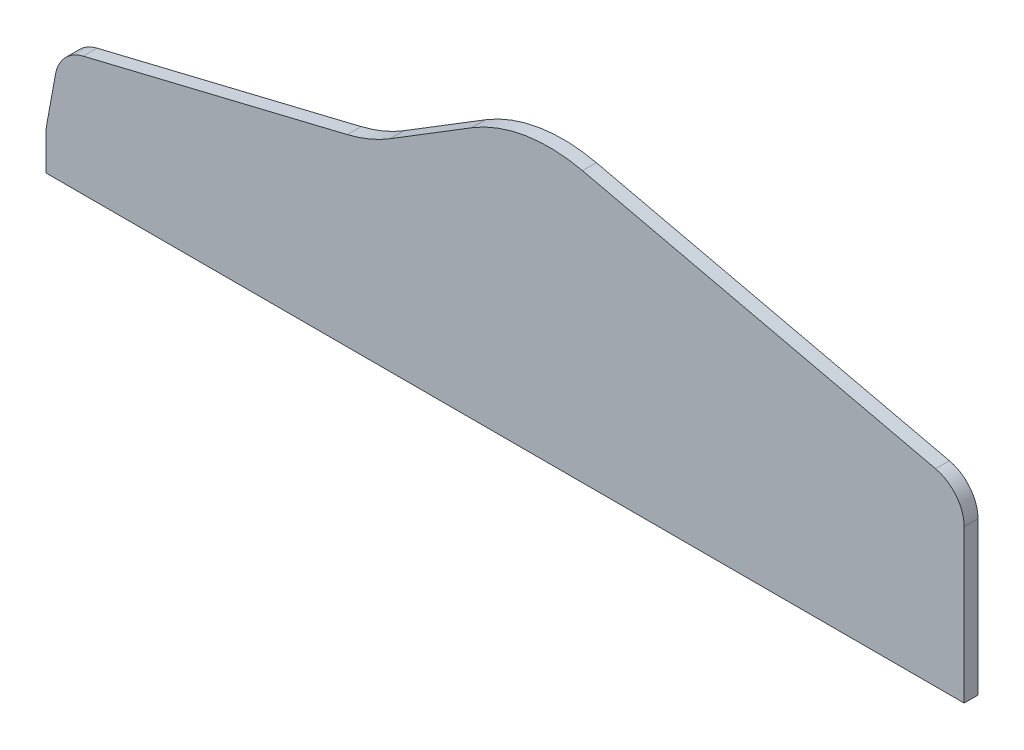
from build123d import *

# Parameters (mm, degrees)
BOSS_EXTRUDE1_DEPTH = 4.7625
FILLET1_R           = 25.4
FILLET2_R           = 101.6


with BuildPart() as part:
    # Sketch2 → Boss-Extrude1 (new, symmetric)
    with BuildSketch(Plane.XY):
        Polygon((-318.797397456, 52.106011358), (-105.437397456, 103.886), (0, 168.8465), (303.09188556, 98.800000012), (303.09188556, 0), (303.09188556, -26.400000032), (-328.331514278, -26.400000032), (-328.331514278, 0), align=None)
    extrude(amount=BOSS_EXTRUDE1_DEPTH, both=True)

    # Fillet1
    fillet1_edges = [part.edges().sort_by_distance(p)[0] for p in [
        (-318.797397456, 52.106011358, 0),
        (303.09188556, 98.800000012, 0),
        (-328.331514278, 0, 0),
    ]]
    fillet(fillet1_edges, radius=FILLET1_R)

    # Fillet2
    fillet2_edges = [part.edges().sort_by_distance(p)[0] for p in [
        (0, 168.8465, 0),
        (-105.437397456, 103.886, 0),
    ]]
    fillet(fillet2_edges, radius=FILLET2_R)


solid = part.part
